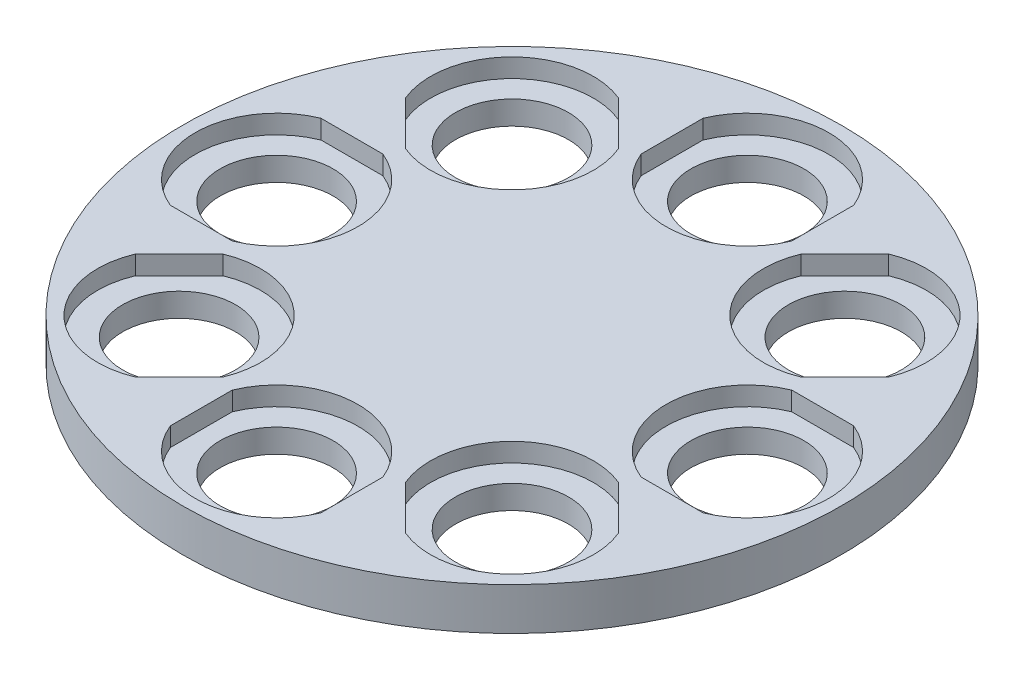
from build123d import *

# Parameters (mm, degrees)
SKETCH1_R           = 70
SKETCH1_R_2         = 12
BOSS_EXTRUDE1_DEPTH = 25
CUT_EXTRUDE1_DEPTH  = 10
SKETCH3_R           = 20
CUT_EXTRUDE2_DEPTH  = 7.5
CUT_EXTRUDE3_START  = -6
SKETCH4_R           = 70
CUT_EXTRUDE3_DEPTH  = 6


with BuildPart() as part:
    # Sketch1 → Boss-Extrude1 (new body)
    with BuildSketch(Plane(origin=(0, 0, 0), x_dir=(1, 0, 0), z_dir=(0, 1, 0))):
        Circle(SKETCH1_R)
        with Locations((50, 0)):
            Circle(SKETCH1_R_2, mode=Mode.SUBTRACT)
        with Locations((35.355339059, -35.355339059)):
            Circle(SKETCH1_R_2, mode=Mode.SUBTRACT)
        with Locations((0, -50)):
            Circle(SKETCH1_R_2, mode=Mode.SUBTRACT)
        with Locations((-35.355339059, -35.355339059)):
            Circle(SKETCH1_R_2, mode=Mode.SUBTRACT)
        with Locations((-50, 0)):
            Circle(SKETCH1_R_2, mode=Mode.SUBTRACT)
        with Locations((-35.355339059, 35.355339059)):
            Circle(SKETCH1_R_2, mode=Mode.SUBTRACT)
        with Locations((0, 50)):
            Circle(SKETCH1_R_2, mode=Mode.SUBTRACT)
        with Locations((35.355339059, 35.355339059)):
            Circle(SKETCH1_R_2, mode=Mode.SUBTRACT)
    extrude(amount=BOSS_EXTRUDE1_DEPTH)

    # Sketch2 → Cut-Extrude1 (cut)
    with BuildSketch(Plane(origin=(0, 25, 0), x_dir=(1, 0, 0), z_dir=(0, 1, 0))):
        with BuildLine():
            Line((50, 16), (43.42048634, 16))
            ThreePointArc((43.42048634, 16), (32.7, 0), (43.42048634, -16))
            Line((43.42048634, -16), (50, -16))
            Line((50, -16), (56.57951366, -16))
            ThreePointArc((56.57951366, -16), (67.3, 0), (56.57951366, 16))
            Line((56.57951366, 16), (50, 16))
        make_face()
        with BuildLine():
            Line((46.669047558, -24.04163056), (42.016628833, -19.389211835))
            ThreePointArc((42.016628833, -19.389211835), (23.122391745, -23.122391745), (19.389211835, -42.016628833))
            Line((19.389211835, -42.016628833), (24.04163056, -46.669047558))
            Line((24.04163056, -46.669047558), (28.694049286, -51.321466284))
            ThreePointArc((28.694049286, -51.321466284), (47.588286374, -47.588286374), (51.321466284, -28.694049286))
            Line((51.321466284, -28.694049286), (46.669047558, -24.04163056))
        make_face()
        with BuildLine():
            Line((16, -50), (16, -43.42048634))
            ThreePointArc((16, -43.42048634), (0, -32.7), (-16, -43.42048634))
            Line((-16, -43.42048634), (-16, -50))
            Line((-16, -50), (-16, -56.57951366))
            ThreePointArc((-16, -56.57951366), (0, -67.3), (16, -56.57951366))
            Line((16, -56.57951366), (16, -50))
        make_face()
        with BuildLine():
            Line((-24.04163056, -46.669047558), (-19.389211835, -42.016628833))
            ThreePointArc((-19.389211835, -42.016628833), (-23.122391745, -23.122391745), (-42.016628833, -19.389211835))
            Line((-42.016628833, -19.389211835), (-46.669047558, -24.04163056))
            Line((-46.669047558, -24.04163056), (-51.321466284, -28.694049286))
            ThreePointArc((-51.321466284, -28.694049286), (-47.588286374, -47.588286374), (-28.694049286, -51.321466284))
            Line((-28.694049286, -51.321466284), (-24.04163056, -46.669047558))
        make_face()
        with BuildLine():
            Line((-50, -16), (-43.42048634, -16))
            ThreePointArc((-43.42048634, -16), (-32.7, 0), (-43.42048634, 16))
            Line((-43.42048634, 16), (-50, 16))
            Line((-50, 16), (-56.57951366, 16))
            ThreePointArc((-56.57951366, 16), (-67.3, 0), (-56.57951366, -16))
            Line((-56.57951366, -16), (-50, -16))
        make_face()
        with BuildLine():
            Line((-46.669047558, 24.04163056), (-42.016628833, 19.389211835))
            ThreePointArc((-42.016628833, 19.389211835), (-23.122391745, 23.122391745), (-19.389211835, 42.016628833))
            Line((-19.389211835, 42.016628833), (-24.04163056, 46.669047558))
            Line((-24.04163056, 46.669047558), (-28.694049286, 51.321466284))
            ThreePointArc((-28.694049286, 51.321466284), (-47.588286374, 47.588286374), (-51.321466284, 28.694049286))
            Line((-51.321466284, 28.694049286), (-46.669047558, 24.04163056))
        make_face()
        with BuildLine():
            Line((-16, 50), (-16, 43.42048634))
            ThreePointArc((-16, 43.42048634), (0, 32.7), (16, 43.42048634))
            Line((16, 43.42048634), (16, 50))
            Line((16, 50), (16, 56.57951366))
            ThreePointArc((16, 56.57951366), (0, 67.3), (-16, 56.57951366))
            Line((-16, 56.57951366), (-16, 50))
        make_face()
        with BuildLine():
            Line((24.04163056, 46.669047558), (19.389211835, 42.016628833))
            ThreePointArc((19.389211835, 42.016628833), (23.122391745, 23.122391745), (42.016628833, 19.389211835))
            Line((42.016628833, 19.389211835), (46.669047558, 24.04163056))
            Line((46.669047558, 24.04163056), (51.321466284, 28.694049286))
            ThreePointArc((51.321466284, 28.694049286), (47.588286374, 47.588286374), (28.694049286, 51.321466284))
            Line((28.694049286, 51.321466284), (24.04163056, 46.669047558))
        make_face()
    extrude(amount=-CUT_EXTRUDE1_DEPTH, mode=Mode.SUBTRACT)


with BuildPart() as body_2:
    # Split1: the piece on the far side of the plane
    add(part.part)
    split(bisect_by=Plane.ZX.offset(10), keep=Keep.BOTTOM)


with BuildPart() as part_1:
    add(part.part)

    # Split1
    split(bisect_by=Plane.ZX.offset(10), keep=Keep.TOP)

    # Sketch3 → Cut-Extrude2 (cut)
    with BuildSketch(Plane.XZ.offset(-10)):
        Circle(SKETCH3_R)
    extrude(amount=-CUT_EXTRUDE2_DEPTH, mode=Mode.SUBTRACT)

    # Sketch4 → Cut-Extrude3 (cut)
    with BuildSketch(Plane(origin=(0, 25, 0), x_dir=(1, 0, 0), z_dir=(0, 1, 0)).offset(CUT_EXTRUDE3_START)):
        Circle(SKETCH4_R)
    extrude(amount=CUT_EXTRUDE3_DEPTH, mode=Mode.SUBTRACT)


solid = part_1.part
